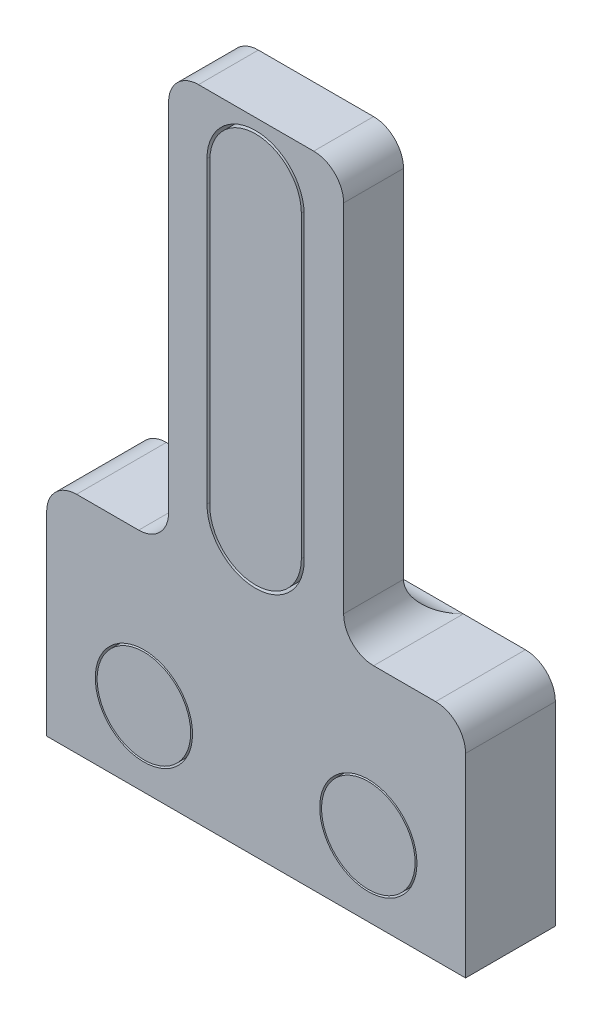
from build123d import *

# Parameters (mm, degrees)
BOSS_EXTRUDE1_DEPTH     = 6
CUT_EXTRUDE1_DEPTH      = 33.32645975048922
CUT_EXTRUDE1_DEPTH_BACK = 33.32645975048922
SKETCH3_R               = 1.7500000000000002
SKETCH3_R_2             = 1.7499999999999998
SKETCH6_R               = 3.2500000000000004
SKETCH6_R_2             = 3.25
CUT_EXTRUDE2_DEPTH      = 3.5
SKETCH7_W               = 11.699999999999998
SKETCH7_H               = 27.786688839798195
BOSS_EXTRUDE2_DEPTH     = 6
SKETCH8_W               = 11.699999999999998
SKETCH8_H               = 27.786688839798195
CUT_EXTRUDE3_DEPTH      = 2
FILLET1_R               = 2
FILLET2_R               = 2
FILLET3_R               = 2
CUT_EXTRUDE4_DEPTH      = 52.48495646180262
CUT_EXTRUDE4_DEPTH_BACK = 52.48495646180262
CUT_EXTRUDE5_DEPTH      = 52.48495646180262
CUT_EXTRUDE5_DEPTH_BACK = 2
FILLET4_R               = 2
FILLET5_R               = 2
SKETCH11_R              = 3.1250000000000004
BOSS_EXTRUDE3_DEPTH     = 3.25
SKETCH11_R_2            = 3.125
BOSS_EXTRUDE3_2_DEPTH   = 3.25
BOSS_EXTRUDE4_DEPTH     = 1.75


with BuildPart() as part:
    # Sketch2 → Boss-Extrude1 (new body)
    with BuildSketch(Plane.XY):
        Polygon((-27.999999999999996, 15), (1.84e-15, 15), (0, 0), (-27.999999999999996, 0), align=None)
    extrude(amount=BOSS_EXTRUDE1_DEPTH)

    # Sketch3 → Cut-Extrude1 (cut, two sides: drawn at the far end of the back side and taken through both)
    with BuildSketch(Plane.XY.offset(6).offset(-CUT_EXTRUDE1_DEPTH_BACK)):
        with Locations((-21.5, 4.999999999999999)):
            Circle(SKETCH3_R)
        with Locations((-6.5, 4.999999999999999)):
            Circle(SKETCH3_R_2)
    extrude(amount=CUT_EXTRUDE1_DEPTH + CUT_EXTRUDE1_DEPTH_BACK, mode=Mode.SUBTRACT)

    # Sketch6 → Cut-Extrude2 (cut)
    with BuildSketch(Plane.XY.offset(6)):
        with Locations((-21.5, 4.999999999999999)):
            Circle(SKETCH6_R)
        with Locations((-6.500000000000001, 4.999999999999999)):
            Circle(SKETCH6_R_2)
    extrude(amount=-CUT_EXTRUDE2_DEPTH, mode=Mode.SUBTRACT)

    # Sketch7 → Boss-Extrude2 (add)
    with BuildSketch(Plane(origin=(0, 0, 0), x_dir=(-1, 0, 0), z_dir=(0, 0, -1))):
        with Locations((14, 28.893344419899098)):
            Rectangle(SKETCH7_W, SKETCH7_H)
    extrude(amount=-BOSS_EXTRUDE2_DEPTH)

    # Sketch8 → Cut-Extrude3 (cut)
    with BuildSketch(Plane(origin=(0, 0, 0), x_dir=(-1, 0, 0), z_dir=(0, 0, -1))):
        with Locations((14, 28.893344419899098)):
            Rectangle(SKETCH8_W, SKETCH8_H)
    extrude(amount=-CUT_EXTRUDE3_DEPTH, mode=Mode.SUBTRACT)

    # Fillet1
    fillet1_edges = [part.edges().sort_by_distance(p)[0] for p in [
        (-14, 15, 2),
    ]]
    fillet(fillet1_edges, radius=FILLET1_R - 0.0001)  # a hair under: the kernel refuses the full size

    # Fillet2
    fillet2_edges = [part.edges().sort_by_distance(p)[0] for p in [
        (-8.15, 15, 3.0000500000000003),
    ]]
    fillet(fillet2_edges, radius=FILLET2_R)

    # Fillet3
    fillet3_edges = [part.edges().sort_by_distance(p)[0] for p in [
        (-19.849999999999998, 15, 3.00005),
    ]]
    fillet(fillet3_edges, radius=FILLET3_R)

    # Sketch9 → Cut-Extrude4 (cut, two sides: drawn at the far end of the back side and taken through both)
    with BuildSketch(Plane.XY.offset(6).offset(-CUT_EXTRUDE4_DEPTH_BACK)):
        with BuildLine():
            Line((-12.28493666219322, 38.78668883979819), (-12.284936662193216, 18.786688839798188))
            ThreePointArc((-12.284936662193216, 18.786688839798188), (-14.034936662193216, 17.036688839798188), (-15.784936662193216, 18.786688839798188))
            Line((-15.784936662193216, 18.786688839798188), (-15.78493666219322, 38.78668883979819))
            ThreePointArc((-15.78493666219322, 38.78668883979819), (-14.03493666219322, 40.53668883979819), (-12.28493666219322, 38.78668883979819))
        make_face()
    extrude(amount=CUT_EXTRUDE4_DEPTH + CUT_EXTRUDE4_DEPTH_BACK, mode=Mode.SUBTRACT)

    # Sketch10 → Cut-Extrude5 (cut, two sides: drawn at the far end of the back side and taken through both)
    with BuildSketch(Plane.XY.offset(6).offset(-CUT_EXTRUDE5_DEPTH_BACK)):
        with BuildLine():
            Line((-10.784936662193223, 38.78668883979819), (-10.78493666219322, 18.786688839798188))
            ThreePointArc((-10.78493666219322, 18.786688839798188), (-14.034936662193216, 15.536688839798186), (-17.284936662193218, 18.786688839798188))
            Line((-17.284936662193218, 18.786688839798188), (-17.284936662193218, 38.78668883979819))
            ThreePointArc((-17.284936662193218, 38.78668883979819), (-14.03493666219322, 42.03668883979819), (-10.784936662193223, 38.78668883979819))
        make_face()
    extrude(amount=CUT_EXTRUDE5_DEPTH + CUT_EXTRUDE5_DEPTH_BACK, mode=Mode.SUBTRACT)

    # Fillet4
    fillet4_edges = [part.edges().sort_by_distance(p)[0] for p in [
        (-8.15, 42.786688839798195, 4),
        (-19.849999999999998, 42.786688839798195, 4),
    ]]
    fillet(fillet4_edges, radius=FILLET4_R)

    # Fillet5
    fillet5_edges = [part.edges().sort_by_distance(p)[0] for p in [
        (-27.999999999999996, 15, 3),
        (1.84e-15, 15, 3),
    ]]
    fillet(fillet5_edges, radius=FILLET5_R)


with BuildPart() as body_2:
    # Sketch11 → Boss-Extrude3 (new body)
    with BuildSketch(Plane.XY.offset(6)):
        with Locations((-21.5, 4.999999999999999)):
            Circle(SKETCH11_R)
    extrude(amount=-BOSS_EXTRUDE3_DEPTH)


with BuildPart() as body_3:
    # Sketch11 → Boss-Extrude3 2 (new body)
    with BuildSketch(Plane.XY.offset(6)):
        with Locations((-6.5, 4.999999999999999)):
            Circle(SKETCH11_R_2)
    extrude(amount=-BOSS_EXTRUDE3_2_DEPTH)


with BuildPart() as body_4:
    # Sketch12 → Boss-Extrude4 (new body)
    with BuildSketch(Plane.XY.offset(6)):
        with BuildLine():
            Line((-10.977197352545545, 38.78668883979819), (-10.977197352545542, 18.786688839798185))
            ThreePointArc((-10.977197352545542, 18.786688839798185), (-14.034936662193216, 15.72894953015051), (-17.09267597184089, 18.786688839798185))
            Line((-17.09267597184089, 18.786688839798185), (-17.092675971840894, 38.78668883979819))
            ThreePointArc((-17.092675971840894, 38.78668883979819), (-14.03493666219322, 41.84442814944586), (-10.977197352545545, 38.78668883979819))
        make_face()
    extrude(amount=-BOSS_EXTRUDE4_DEPTH)


solid = Compound([part.part, body_2.part, body_3.part, body_4.part])
